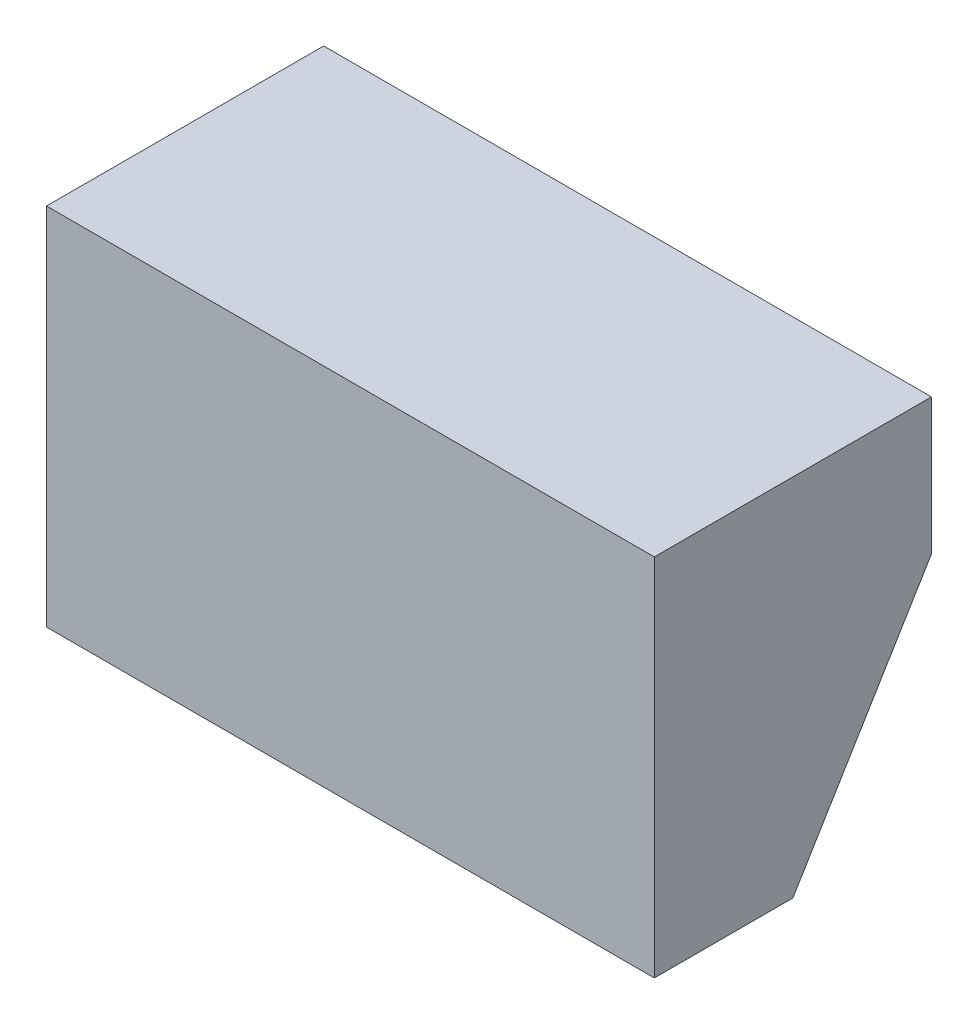
from build123d import *

# Parameters (mm, degrees)
SKETCH1_W           = 250
SKETCH1_H           = 150
BOSS_EXTRUDE1_DEPTH = 114
SKETCH4_W           = 158.825989779
SKETCH4_H           = 169.09880145
CUT_EXTRUDE1_DEPTH  = 114


with BuildPart() as part:
    # Sketch1 → Boss-Extrude1 (new body)
    with BuildSketch(Plane.XY):
        Rectangle(SKETCH1_W, SKETCH1_H)
    extrude(amount=BOSS_EXTRUDE1_DEPTH)

    # Sketch4 → Cut-Extrude1 (cut)
    with BuildSketch(Plane(origin=(27.906934923, -24.538252492, -40.49320945), x_dir=(0.8614948455361232, 0.2631519435385569, 0.4342553231988889), z_dir=(-0.5077663154588844, 0.4464731827403718, 0.7367734156299286))):
        with Locations((63.082324951, -59.282681283)):
            Rectangle(SKETCH4_W, SKETCH4_H)
    extrude(amount=-CUT_EXTRUDE1_DEPTH, mode=Mode.SUBTRACT)


solid = part.part
